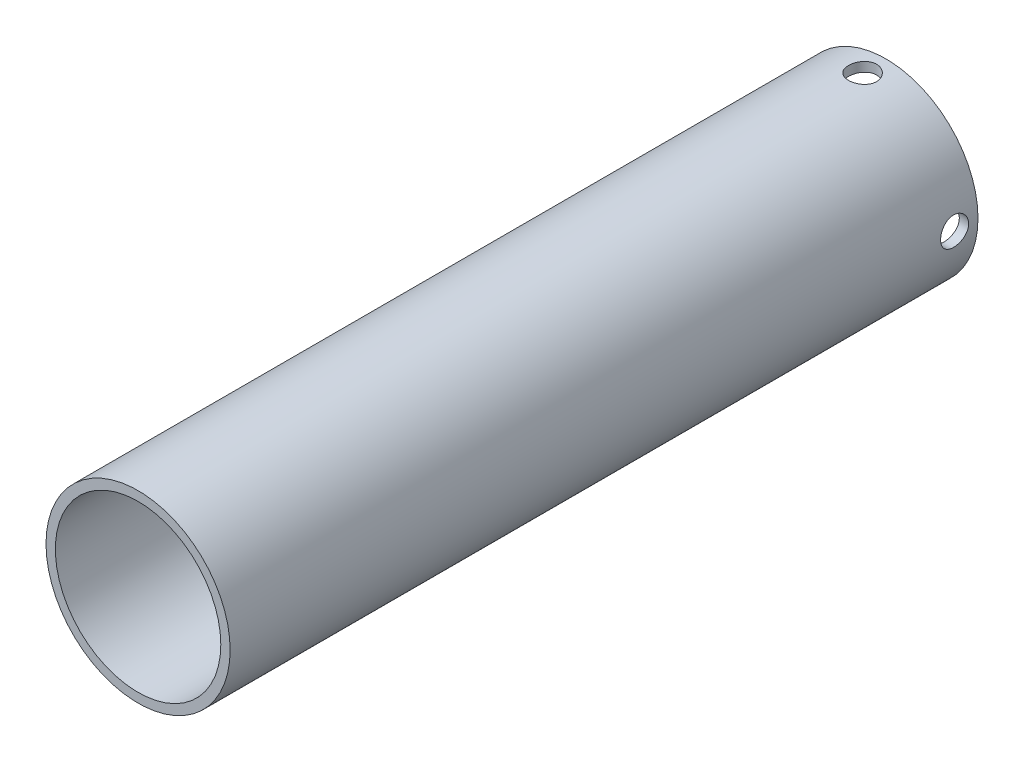
from build123d import *

# Parameters (mm, degrees)
ESBO_O1_R                = 9.85
ESBO_O1_R_2              = 8.85
RESSALTO_EXTRUS_O1_DEPTH = 80
ESBO_O3_R                = 1.5
CORTE_EXTRUS_O1_DEPTH    = 82.203725284
PADR_OCIRCULAR1_COUNT    = 4


with BuildPart() as part:
    # Esboço1 → Ressalto-extrusão1 (new body)
    with BuildSketch(Plane.XY):
        Circle(ESBO_O1_R)
        Circle(ESBO_O1_R_2, mode=Mode.SUBTRACT)
    extrude(amount=RESSALTO_EXTRUS_O1_DEPTH)

    # Esboço3 → Corte-extrusão1 (cut, through all)
    with BuildSketch(Plane(origin=(0, 0, 0), x_dir=(1, 0, 0), z_dir=(0, 1, 0))):
        with Locations((0, -2.5)):
            Circle(ESBO_O3_R)
    corte_extrus_o1 = extrude(amount=-CORTE_EXTRUS_O1_DEPTH, mode=Mode.SUBTRACT)

    # PadrãoCircular1: Corte-extrusão1 ×4 about axis
    padr_ocircular1_axis = Axis((0, 0, 0), (0, 0, 1))
    for i in range(1, PADR_OCIRCULAR1_COUNT):
        add(corte_extrus_o1.rotate(padr_ocircular1_axis, i * 360 / PADR_OCIRCULAR1_COUNT), mode=Mode.SUBTRACT)


solid = part.part
